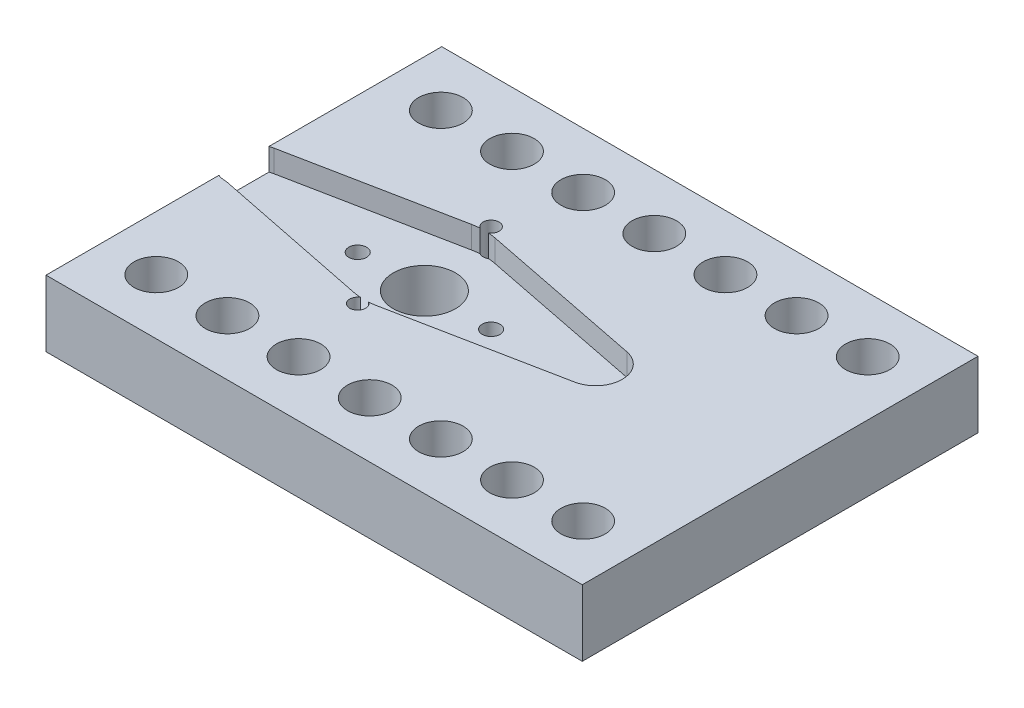
from build123d import *

# Parameters (mm, degrees)
SKETCH3_W           = 60.3
SKETCH3_H           = 44.5
SKETCH3_R           = 0.9
SKETCH3_R_2         = 1
SKETCH3_R_3         = 3.5
BOSS_EXTRUDE1_DEPTH = 7.46
CUT_EXTRUDE1_DEPTH  = 2.5
SKETCH6_R           = 2.5
CUT_EXTRUDE3_DEPTH  = 39.206499447


with BuildPart() as part:
    # Sketch3 → Boss-Extrude1 (new body)
    with BuildSketch(Plane(origin=(0, 0, 0), x_dir=(1, 0, 0), z_dir=(0, 1, 0))):
        Rectangle(SKETCH3_W, SKETCH3_H)
        with Locations((-9.85, 7.5)):
            Circle(SKETCH3_R, mode=Mode.SUBTRACT)
        with Locations((-17.35, 0)):
            Circle(SKETCH3_R_2, mode=Mode.SUBTRACT)
        with Locations((-9.85, -7.5)):
            Circle(SKETCH3_R, mode=Mode.SUBTRACT)
        with Locations((-2.35, 0)):
            Circle(SKETCH3_R_2, mode=Mode.SUBTRACT)
        with Locations((-9.85, 0)):
            Circle(SKETCH3_R_3, mode=Mode.SUBTRACT)
    extrude(amount=BOSS_EXTRUDE1_DEPTH)

    # Sketch4 → Cut-Extrude1 (cut)
    with BuildSketch(Plane(origin=(0, 7.46, 0), x_dir=(1, 0, 0), z_dir=(0, 1, 0))):
        with BuildLine():
            Line((-29.684415584, 2.942525858), (-11.164935065, 6.62068318))
            ThreePointArc((-11.164935065, 6.62068318), (-9.85, 6.75), (-8.535064935, 6.62068318))
            Line((-8.535064935, 6.62068318), (9.984415584, 2.942525858))
            ThreePointArc((9.984415584, 2.942525858), (12.4, 0), (9.984415584, -2.942525858))
            Line((9.984415584, -2.942525858), (-8.535064935, -6.62068318))
            ThreePointArc((-8.535064935, -6.62068318), (-9.860607708, -6.749991665), (-11.185737515, -6.616517611))
            Line((-11.185737515, -6.616517611), (-29.1, -3))
            ThreePointArc((-29.1, -3), (-32.08559689, -0.29361746), (-29.684415584, 2.942525858))
        make_face()
    extrude(amount=-CUT_EXTRUDE1_DEPTH, mode=Mode.SUBTRACT)

    # Sketch6 → Cut-Extrude3 (cut, through all)
    with BuildSketch(Plane(origin=(0, 7.46, 0), x_dir=(1, 0, 0), z_dir=(0, 1, 0))):
        with Locations((0, 16)):
            Circle(SKETCH6_R)
        with Locations((8, 16)):
            Circle(SKETCH6_R)
        with Locations((16, 16)):
            Circle(SKETCH6_R)
        with Locations((24, 16)):
            Circle(SKETCH6_R)
        with Locations((-24, 16)):
            Circle(SKETCH6_R)
        with Locations((-16, 16)):
            Circle(SKETCH6_R)
        with Locations((-8, 16)):
            Circle(SKETCH6_R)
        with Locations((24, -16)):
            Circle(SKETCH6_R)
        with Locations((16, -16)):
            Circle(SKETCH6_R)
        with Locations((8, -16)):
            Circle(SKETCH6_R)
        with Locations((0, -16)):
            Circle(SKETCH6_R)
        with Locations((-8, -16)):
            Circle(SKETCH6_R)
        with Locations((-16, -16)):
            Circle(SKETCH6_R)
        with Locations((-24, -16)):
            Circle(SKETCH6_R)
    extrude(amount=-CUT_EXTRUDE3_DEPTH, mode=Mode.SUBTRACT)


solid = part.part
